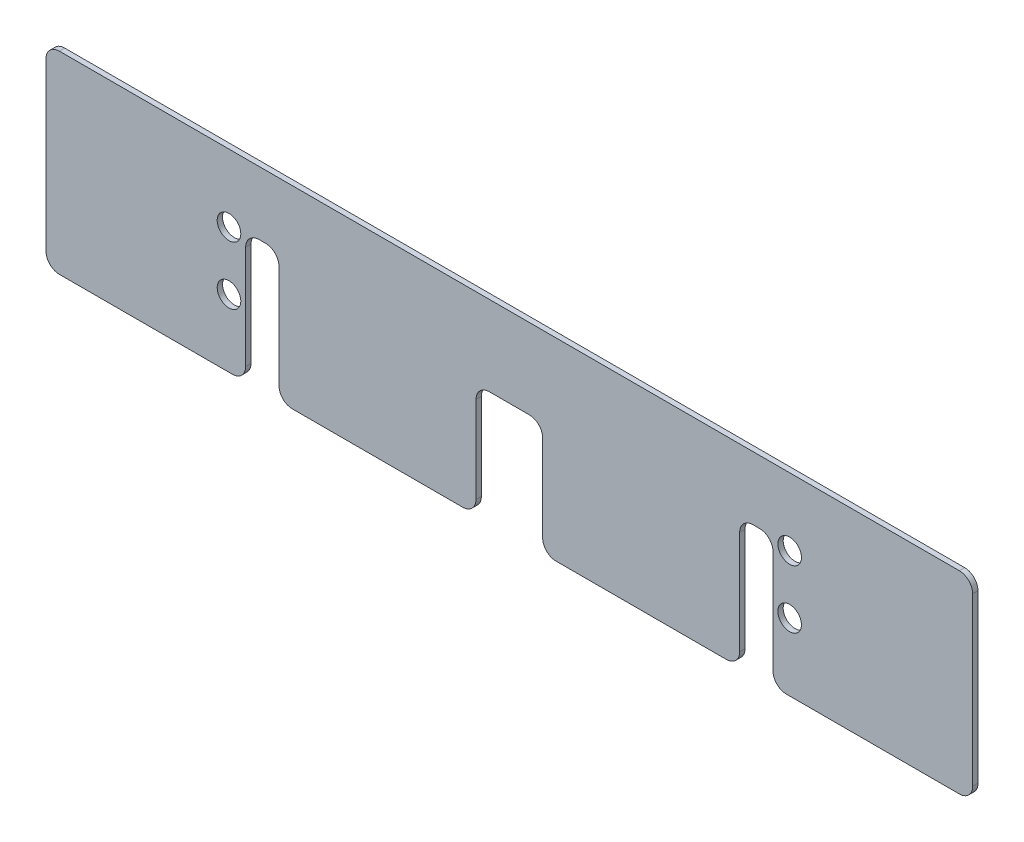
from build123d import *

# Parameters (mm, degrees)
STOCK_HAMMERSAW_START                 = -20.066
STOCK_HAMMERSAW_MULTIBODY_1_OUTLINE_R = 2.2479
STOCK_HAMMERSAW_MULTIBODY_1_DEPTH     = 1.016
SKETCH1_W                             = 177.8
SKETCH1_H                             = 38.1
SKETCH1_W_2                           = 176.53
SKETCH1_H_2                           = 36.83
CUT_EXTRUDE1_DEPTH                    = 103.395714051
FILLET1_R                             = 2.54


# Read off the part's stored shape, not the designer's step: Stock-HammerSaw Multibody-1
with BuildPart() as part:
    # Stock-HammerSaw Multibody-1 outline → Stock-HammerSaw Multibody-1 (new body)
    with BuildSketch(Plane.XY.offset(STOCK_HAMMERSAW_START)):
        Polygon((6.35, 12.7), (43.8785, 12.7), (43.8785, 38.1), (50.2285, 38.1), (50.2285, 12.7), (88.9, 12.7), (88.9, 50.8), (-88.9, 50.8), (-88.9, 12.7), (-50.2285, 12.7), (-50.2285, 38.1), (-43.8785, 38.1), (-43.8785, 12.7), (-6.35, 12.7), (-6.35, 34.925), (6.35, 34.925), align=None)
        with Locations((-53.4035, 26.19375)):
            Circle(STOCK_HAMMERSAW_MULTIBODY_1_OUTLINE_R, mode=Mode.SUBTRACT)
        with Locations((53.4035, 26.19375)):
            Circle(STOCK_HAMMERSAW_MULTIBODY_1_OUTLINE_R, mode=Mode.SUBTRACT)
        with Locations((-53.4035, 37.30625)):
            Circle(STOCK_HAMMERSAW_MULTIBODY_1_OUTLINE_R, mode=Mode.SUBTRACT)
        with Locations((53.4035, 37.30625)):
            Circle(STOCK_HAMMERSAW_MULTIBODY_1_OUTLINE_R, mode=Mode.SUBTRACT)
    extrude(amount=STOCK_HAMMERSAW_MULTIBODY_1_DEPTH)

    # Sketch1 → Cut-Extrude1 (cut, through all)
    with BuildSketch(Plane(origin=(0, 0, -20.066), x_dir=(-1, 0, 0), z_dir=(0, 0, -1))):
        with Locations((0, 31.75)):
            Rectangle(SKETCH1_W, SKETCH1_H)
        with Locations((0, 31.75)):
            Rectangle(SKETCH1_W_2, SKETCH1_H_2, mode=Mode.SUBTRACT)
    extrude(amount=-CUT_EXTRUDE1_DEPTH, mode=Mode.SUBTRACT)

    # Fillet1
    fillet1_edges = [part.edges().sort_by_distance(p)[0] for p in [
        (-6.35, 13.335, -19.558),
        (88.265, 13.335, -19.558),
        (50.2285, 13.335, -19.558),
        (43.8785, 13.335, -19.558),
        (-50.2285, 13.335, -19.558),
        (-43.8785, 13.335, -19.558),
        (-88.265, 50.165, -19.558),
        (-88.265, 13.335, -19.558),
        (6.35, 13.335, -19.558),
        (88.265, 50.165, -19.558),
        (6.35, 34.925, -19.558),
        (-6.35, 34.925, -19.558),
        (-50.2285, 38.1, -19.558),
        (-43.8785, 38.1, -19.558),
        (50.2285, 38.1, -19.558),
        (43.8785, 38.1, -19.558),
    ]]
    fillet(fillet1_edges, radius=FILLET1_R)


solid = part.part
